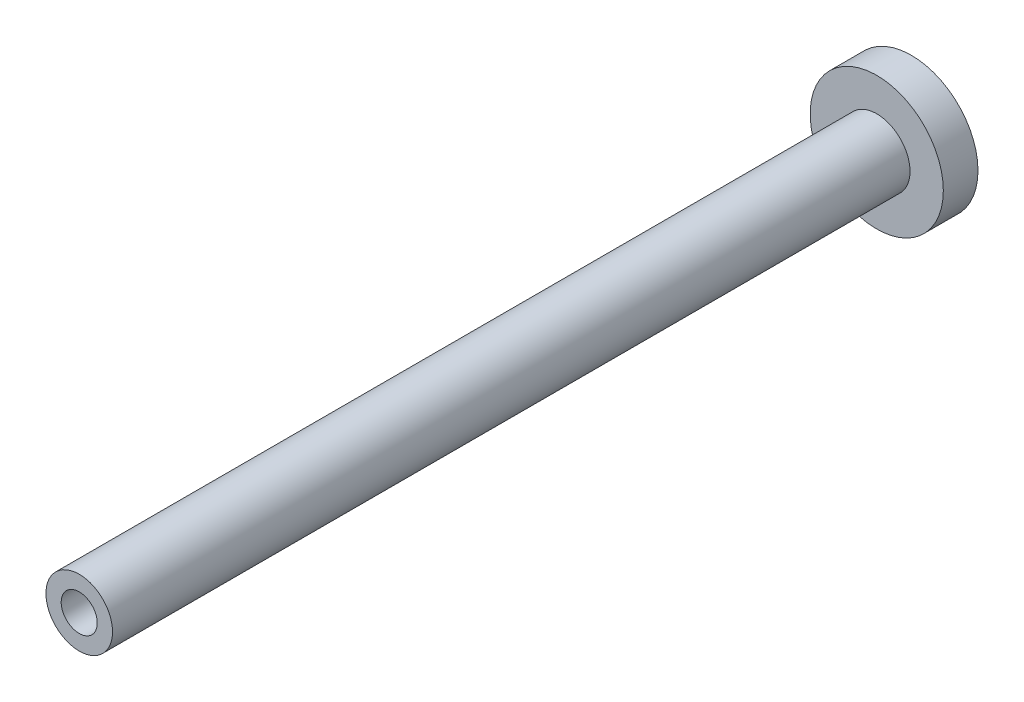
from build123d import *

# Parameters (mm, degrees)
SKETCH1_R           = 4.8
BOSS_EXTRUDE1_DEPTH = 60
SKETCH6_R           = 1.25
BOSS_EXTRUDE2_DEPTH = 2.5
SKETCH7_R           = 1.3
CUT_EXTRUDE1_DEPTH  = 2.5
SKETCH9_OUTSIDE_W   = 24.392
SKETCH9_OUTSIDE_H   = 24.392
SKETCH9_OUTSIDE_R   = 2.4
CUT_EXTRUDE2_DEPTH  = 57.5


with BuildPart() as part:
    # Sketch1 → Boss-Extrude1 (new body)
    with BuildSketch(Plane.XY):
        Circle(SKETCH1_R)
    extrude(amount=BOSS_EXTRUDE1_DEPTH)

    # Sketch6 → Boss-Extrude2 (add)
    with BuildSketch(Plane(origin=(0, 0, 0), x_dir=(-1, 0, 0), z_dir=(0, 0, -1))):
        Circle(SKETCH6_R)
    extrude(amount=BOSS_EXTRUDE2_DEPTH)

    # Sketch7 → Cut-Extrude1 (cut)
    with BuildSketch(Plane.XY.offset(60)):
        Circle(SKETCH7_R)
    extrude(amount=-CUT_EXTRUDE1_DEPTH, mode=Mode.SUBTRACT)

    # Sketch9 outside → Cut-Extrude2 (cut)
    with BuildSketch(Plane.XY.offset(60)):
        Rectangle(SKETCH9_OUTSIDE_W, SKETCH9_OUTSIDE_H)
        Circle(SKETCH9_OUTSIDE_R, mode=Mode.SUBTRACT)
    extrude(amount=-CUT_EXTRUDE2_DEPTH, mode=Mode.SUBTRACT)


solid = part.part
